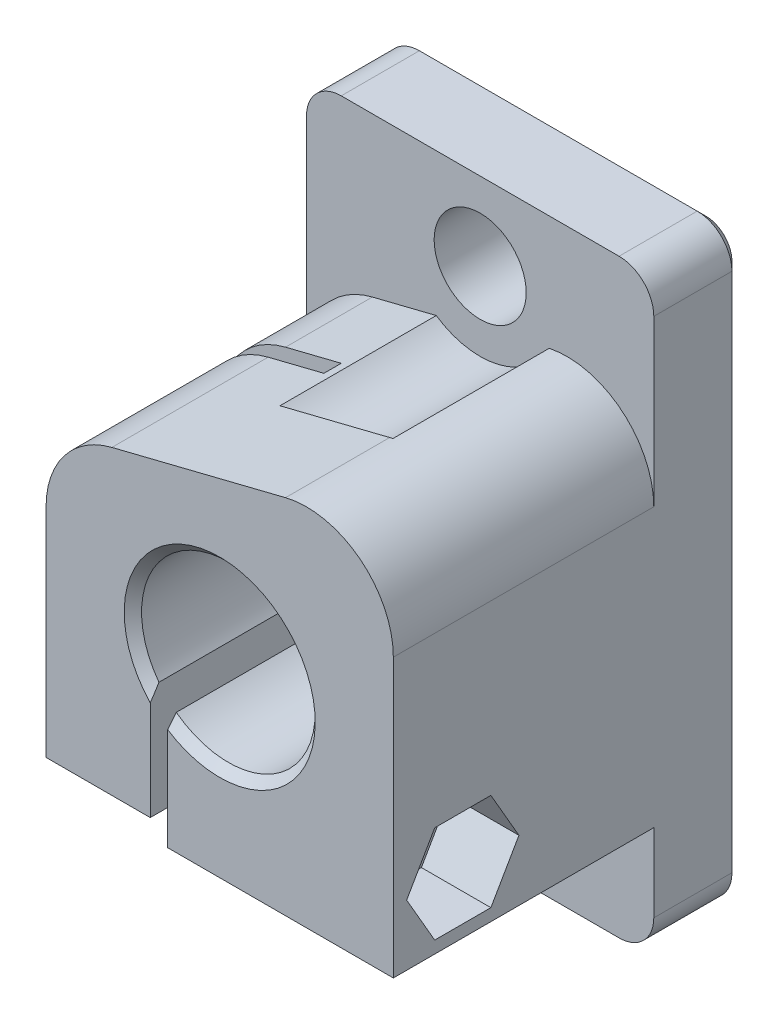
from build123d import *

# Parameters (mm, degrees)
ESBO_O1_W                = 20
ESBO_O1_H                = 34
ESBO_O1_R                = 5
ESBO_O1_R_2              = 2.65
RESSALTO_EXTRUS_O1_DEPTH = 5
ESBO_O2_R                = 5
RESSALTO_EXTRUS_O2_DEPTH = 20
CORTE_EXTRUS_O1_START    = -9
CORTE_EXTRUS_O1_DEPTH    = 9
CORTE_EXTRUS_O3_REACH    = 46.227
ESBO_O5_R                = 1.65
CORTE_EXTRUS_O2_DEPTH    = 4
FILETE1_R                = 5
FILETE2_R                = 2
CORTE_EXTRUS_O4_START    = -15
ESBO_O6_R                = 4.75
CORTE_EXTRUS_O4_DEPTH    = 8
ESBO_O7_R                = 5
RESSALTO_EXTRUS_O3_DEPTH = 10
ESBO_O8_W                = 1
ESBO_O8_H                = 21.001730979
CORTE_EXTRUS_O5_DEPTH    = 7
ESBO_O10_R               = 4.5
CORTE_EXTRUS_O7_DEPTH    = 8
CHANFRO5_SIZE            = 1.732050808
CHANFRO5_SIZE_2          = 1
CORTE_EXTRUS_O8_START    = -10
CORTE_EXTRUS_O8_DEPTH    = 10
CHANFRO2_SIZE            = 0.5


with BuildPart() as part:
    # Esboço1 → Ressalto-extrusão1 (new body)
    with BuildSketch(Plane.XY):
        with Locations((10, 17)):
            Rectangle(ESBO_O1_W, ESBO_O1_H)
        with Locations((10, 17)):
            Circle(ESBO_O1_R, mode=Mode.SUBTRACT)
        with Locations((10, 29.5)):
            Circle(ESBO_O1_R_2, mode=Mode.SUBTRACT)
        with Locations((10, 4.5)):
            Circle(ESBO_O1_R_2, mode=Mode.SUBTRACT)
    extrude(amount=RESSALTO_EXTRUS_O1_DEPTH)

    # Esboço2 → Ressalto-extrusão2 (add)
    with BuildSketch(Plane(origin=(0, 0, 0), x_dir=(-1, 0, 0), z_dir=(0, 0, -1))):
        Polygon((0, 23.914879084), (-20, 28.90143914), (-20, 6.5), (0, 6.5), align=None)
        with Locations((-10, 17)):
            Circle(ESBO_O2_R, mode=Mode.SUBTRACT)
    extrude(amount=-RESSALTO_EXTRUS_O2_DEPTH)

    # Esboço3 → Corte-extrusão1 (cut)
    with BuildSketch(Plane.XY.offset(20).offset(CORTE_EXTRUS_O1_START)):
        with BuildLine():
            Line((6, 14), (6, 7.5))
            Line((6, 7.5), (0, 7.5))
            Line((0, 7.5), (0, 6.5))
            Line((0, 6.5), (7, 6.5))
            Line((7, 6.5), (7, 13))
            ThreePointArc((7, 13), (6.464466094, 13.464466094), (6, 14))
        make_face()
    extrude(amount=CORTE_EXTRUS_O1_DEPTH, mode=Mode.SUBTRACT)

    # Corte-extrusão3: up to this face of the body (flat: up to its plane)
    corte_extrus_o3_end = Plane(part.part.faces().sort_by_distance((20, 17.465309995, 9.140459531))[0])
    # Esboço5 → Corte-extrusão3 (cut, up to the picked face)
    with BuildSketch(Plane.ZY, mode=Mode.PRIVATE) as corte_extrus_o3_sk1:
        with Locations((16, 10)):
            Circle(ESBO_O5_R)
    corte_extrus_o3_tool1 = split(extrude(corte_extrus_o3_sk1.sketch, amount=-CORTE_EXTRUS_O3_REACH, mode=Mode.PRIVATE), bisect_by=corte_extrus_o3_end, keep=Keep.BOTH, mode=Mode.PRIVATE)
    add(corte_extrus_o3_tool1.solids().sort_by(Axis((0, 10, 16), (1, 0, 0)))[0], mode=Mode.SUBTRACT)

    # Esboço4 → Corte-extrusão2 (cut)
    with BuildSketch(Plane(origin=(20, 0, 0), x_dir=(0, 0, -1), z_dir=(1, 0, 0))):
        Polygon((-19.233161507, 10), (-17.616580754, 7.2), (-14.383419246, 7.2), (-12.766838493, 10), (-14.383419246, 12.8), (-17.616580754, 12.8), align=None)
    extrude(amount=-CORTE_EXTRUS_O2_DEPTH, mode=Mode.SUBTRACT)

    # Filete1
    filete1_edges = [part.edges().sort_by_distance(p)[0] for p in [
        (0, 23.914879084, 12.5),
        (20, 28.90143914, 12.5),
    ]]
    fillet(filete1_edges, radius=FILETE1_R)

    # Filete2
    filete2_edges = [part.edges().sort_by_distance(p)[0] for p in [
        (0, 34, 2.5),
        (20, 34, 2.5),
        (20, 0, 2.5),
        (0, 0, 2.5),
    ]]
    fillet(filete2_edges, radius=FILETE2_R)

    # Esboço6 → Corte-extrusão4 (cut)
    with BuildSketch(Plane.XY.offset(20).offset(CORTE_EXTRUS_O4_START)):
        with Locations((10, 4.5)):
            Circle(ESBO_O6_R)
    extrude(amount=CORTE_EXTRUS_O4_DEPTH, mode=Mode.SUBTRACT)

    # Esboço7 → Ressalto-extrusão3 (add)
    with BuildSketch(Plane(origin=(0, 0, 0), x_dir=(-1, 0, 0), z_dir=(0, 0, -1))):
        with Locations((-10, 17)):
            Circle(ESBO_O7_R)
    extrude(amount=-RESSALTO_EXTRUS_O3_DEPTH)

    # Esboço8 → Corte-extrusão5 (cut)
    with BuildSketch(Plane.ZY):
        with Locations((10.5, 17.00086549)):
            Rectangle(ESBO_O8_W, ESBO_O8_H)
    extrude(amount=-CORTE_EXTRUS_O5_DEPTH, mode=Mode.SUBTRACT)

    # Esboço10 → Corte-extrusão7 (cut)
    with BuildSketch(Plane.XY.offset(5)):
        with Locations((10, 29.5)):
            Circle(ESBO_O10_R)
    extrude(amount=CORTE_EXTRUS_O7_DEPTH, mode=Mode.SUBTRACT)

    # Chanfro5
    # the kernel refuses this chamfer: 1.732050808, 1 mm, written as the material it takes off along each edge
    with BuildSketch(Plane(origin=(18.789385955, 6.5, 13), x_dir=(0, 0.9998132206222079, -0.019326765612700685), z_dir=(-1, 0, 0))) as chanfro5_piece_1_section:
        Polygon((CHANFRO5_SIZE * 0.999813220373, -CHANFRO5_SIZE * 0.0193267656079), (-CHANFRO5_SIZE_2 * 0.0193267656127, -CHANFRO5_SIZE_2 * 0.999813220622), (0, 0), align=None)
    chanfro5_piece_1 = extrude(amount=16.270349926, mode=Mode.PRIVATE)
    chanfro5_piece_1 = chanfro5_piece_1 & Plane(origin=(10, 4.5, 13.142171605), x_dir=(1, 0, 0), z_dir=(0, 0, -1)) * Cylinder(4.75, 40, mode=Mode.PRIVATE)
    add(chanfro5_piece_1, mode=Mode.SUBTRACT)
    with BuildSketch(Plane(origin=(3.123434693, 24.693638818, 13), x_dir=(-0.014005792936040639, 0.056174167266921864, 0.9983227437537926), z_dir=(0.9702957262759956, 0.2419218955996716, 0))) as chanfro5_piece_2_section:
        Polygon((CHANFRO5_SIZE_2 * 0.998322743754, CHANFRO5_SIZE_2 * 0.0578938624027), (-CHANFRO5_SIZE * 0.0578938623883, CHANFRO5_SIZE * 0.998322743505), (0, 0), align=None)
    chanfro5_piece_2 = extrude(amount=10.993510061, mode=Mode.PRIVATE)
    chanfro5_piece_2 = chanfro5_piece_2 & Plane(origin=(10, 29.5, 13.381027624), x_dir=(1, 0, 0), z_dir=(0, 0, -1)) * Cylinder(4.5, 29, mode=Mode.PRIVATE)
    add(chanfro5_piece_2, mode=Mode.SUBTRACT)
    with BuildSketch(Plane(origin=(15, 22.501730979, 13), x_dir=(0.6367879492997914, 0.7710389793172368, 0), z_dir=(0.7710389793172368, -0.6367879492997914, 0))) as chanfro5_piece_3_section:
        Polygon((5 - CHANFRO5_SIZE, 0), (5, CHANFRO5_SIZE_2), (5, 0), align=None)
    chanfro5_piece_3 = revolve(axis=Axis((15, 22.501730979, 13), (0, 0, 1)), revolution_arc=53.552719823, mode=Mode.PRIVATE)
    chanfro5_piece_3 = chanfro5_piece_3 & Plane(origin=(10, 29.5, 13.480391977), x_dir=(1, 0, 0), z_dir=(0, 0, -1)) * Cylinder(4.5, 20, mode=Mode.PRIVATE)
    add(chanfro5_piece_3, mode=Mode.SUBTRACT)

    # Esboço11 → Corte-extrusão8 (cut)
    with BuildSketch(Plane.XY.offset(5).offset(CORTE_EXTRUS_O8_START)):
        with BuildLine():
            ThreePointArc((8.261466135, 6.5), (10, 1.85), (11.738533865, 6.5))
            ThreePointArc((11.738533865, 6.5), (10, 7.15), (8.261466135, 6.5))
        make_face()
    extrude(amount=CORTE_EXTRUS_O8_DEPTH, mode=Mode.SUBTRACT)

    # Chanfro2
    chanfro2_edges = [part.edges().sort_by_distance(p)[0] for p in [
        (10, 34, 0),
        (20, 17, 0),
        (10, 0, 0),
        (0, 17, 0),
        (0.585786438, 33.414213562, 0),
        (0.585786438, 0.585786438, 0),
        (19.414213562, 0.585786438, 0),
        (19.414213562, 33.414213562, 0),
        (7.35, 29.5, 0),
        (8.261466135, 2.5, 0),
        (13.535533906, 20.535533906, 20),
    ]]
    chamfer(chanfro2_edges, length=CHANFRO2_SIZE)


solid = part.part
